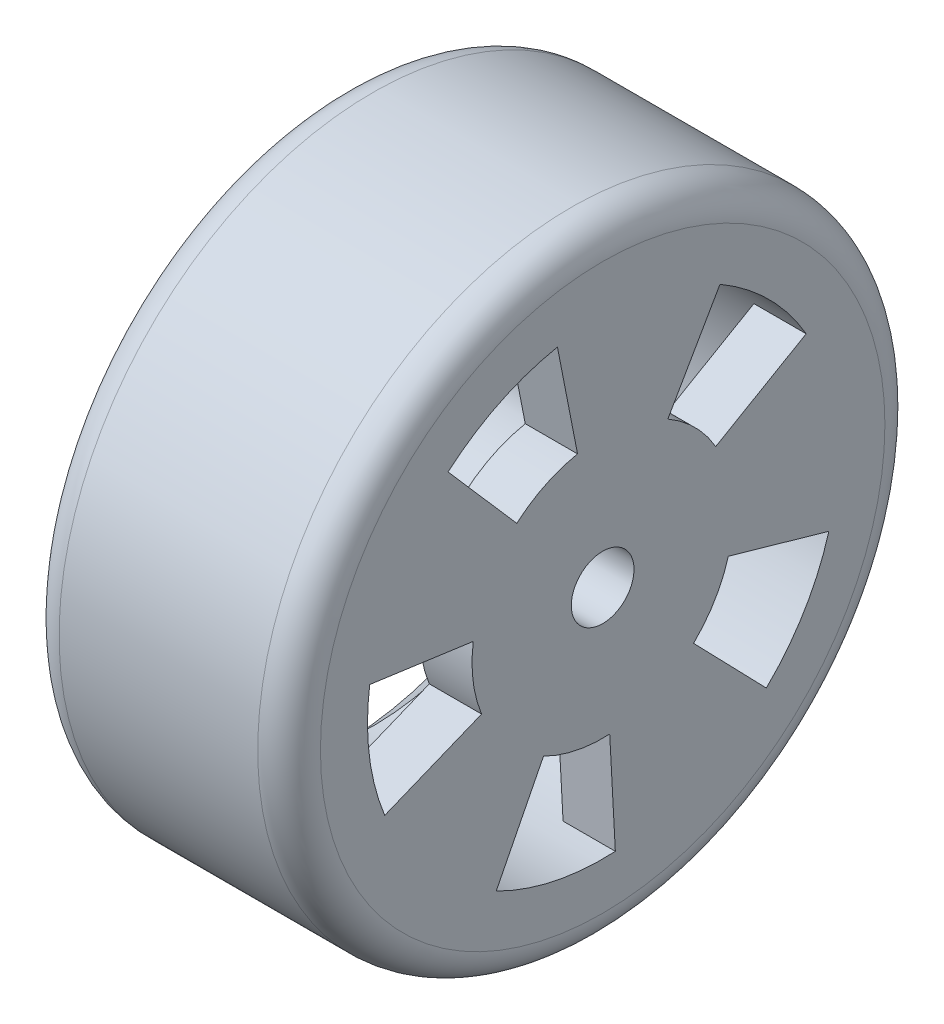
from build123d import *
from build123d.topology import SkipClean

# Parameters (mm, degrees)
SKETCH1_R           = 30
BOSS_EXTRUDE1_DEPTH = 25
FILLET1_R           = 3
SKETCH3_R           = 22.5
CUT_EXTRUDE1_DEPTH  = 20
CHAMFER1_SIZE       = 3
CUT_EXTRUDE2_DEPTH  = 50.244289131
CIRPATTERN1_COUNT   = 5
CIRPATTERN1_ANGLE   = 284
SKETCH4_R           = 10
BOSS_EXTRUDE2_DEPTH = 15
SKETCH5_R           = 3
CUT_EXTRUDE3_DEPTH  = 47.904157726
SKETCH6_R           = 2
CUT_EXTRUDE4_DEPTH  = 50.244289131
SKETCH7_R           = 4
CUT_EXTRUDE5_DEPTH  = 64.442887868


with BuildPart() as part:
    # Sketch1 → Boss-Extrude1 (new body)
    with BuildSketch(Plane(origin=(0, 0, 0), x_dir=(0, 0, -1), z_dir=(1, 0, 0))):
        Circle(SKETCH1_R)
    extrude(amount=BOSS_EXTRUDE1_DEPTH)

    # Fillet1
    fillet1_edges = [part.edges().sort_by_distance(p)[0] for p in [
        (0, 0, 30),
        (25, 0, 30),
    ]]
    fillet(fillet1_edges, radius=FILLET1_R)

    # Sketch3 → Cut-Extrude1 (cut)
    with BuildSketch(Plane.ZY):
        Circle(SKETCH3_R)
    extrude(amount=-CUT_EXTRUDE1_DEPTH, mode=Mode.SUBTRACT)

    # Chamfer1
    chamfer1_edges = [part.edges().sort_by_distance(p)[0] for p in [
        (0, 0, -22.5),
    ]]
    chamfer(chamfer1_edges, length=CHAMFER1_SIZE)

    # Sketch2 → Cut-Extrude2 (cut, through all)
    with BuildSketch(Plane.ZY.offset(-25)):
        with BuildLine():
            Line((-6.233158363, 10.835023619), (-11.219685054, 19.503042514))
            ThreePointArc((-11.219685054, 19.503042514), (-15.885142396, 15.934624283), (-19.468053536, 11.280287741))
            Line((-19.468053536, 11.280287741), (-10.815585298, 6.266826523))
            ThreePointArc((-10.815585298, 6.266826523), (-8.825079109, 8.852569046), (-6.233158363, 10.835023619))
        make_face()
    cut_extrude2 = extrude(amount=CUT_EXTRUDE2_DEPTH, mode=Mode.SUBTRACT)

    # CirPattern1: Cut-Extrude2 ×5 about axis
    with SkipClean():  # the faces are left unmerged after this step: merging them gives an invalid solid
        cirpattern1_axis = Axis((25, 0, 0), (1, 0, 0))
        for i in range(1, CIRPATTERN1_COUNT):
            add(cut_extrude2.rotate(cirpattern1_axis, i * CIRPATTERN1_ANGLE / (CIRPATTERN1_COUNT - 1)), mode=Mode.SUBTRACT)
    add(part.part.scale(1), mode=Mode.REPLACE)  # the faces are merged on a copy

    # Sketch4 → Boss-Extrude2 (add)
    with BuildSketch(Plane.ZY.offset(-20)):
        Circle(SKETCH4_R)
    extrude(amount=BOSS_EXTRUDE2_DEPTH)

    # Sketch5 → Cut-Extrude3 (cut, through all)
    with BuildSketch(Plane.ZY.offset(-5)):
        Circle(SKETCH5_R)
    extrude(amount=-CUT_EXTRUDE3_DEPTH, mode=Mode.SUBTRACT)

    # Sketch6 → Cut-Extrude4 (cut, through all)
    with BuildSketch(Plane(origin=(0, 0, 0), x_dir=(1, 0, 0), z_dir=(0, 1, 0))):
        with Locations((12.5, 0)):
            Circle(SKETCH6_R)
    extrude(amount=-CUT_EXTRUDE4_DEPTH, mode=Mode.SUBTRACT)

    # Sketch7 → Cut-Extrude5 (cut, through all)
    with BuildSketch(Plane(origin=(0, -20, 0), x_dir=(1, 0, 0), z_dir=(0, 1, 0))):
        with Locations((12.5, 0)):
            Circle(SKETCH7_R)
    extrude(amount=-CUT_EXTRUDE5_DEPTH, mode=Mode.SUBTRACT)


solid = part.part
